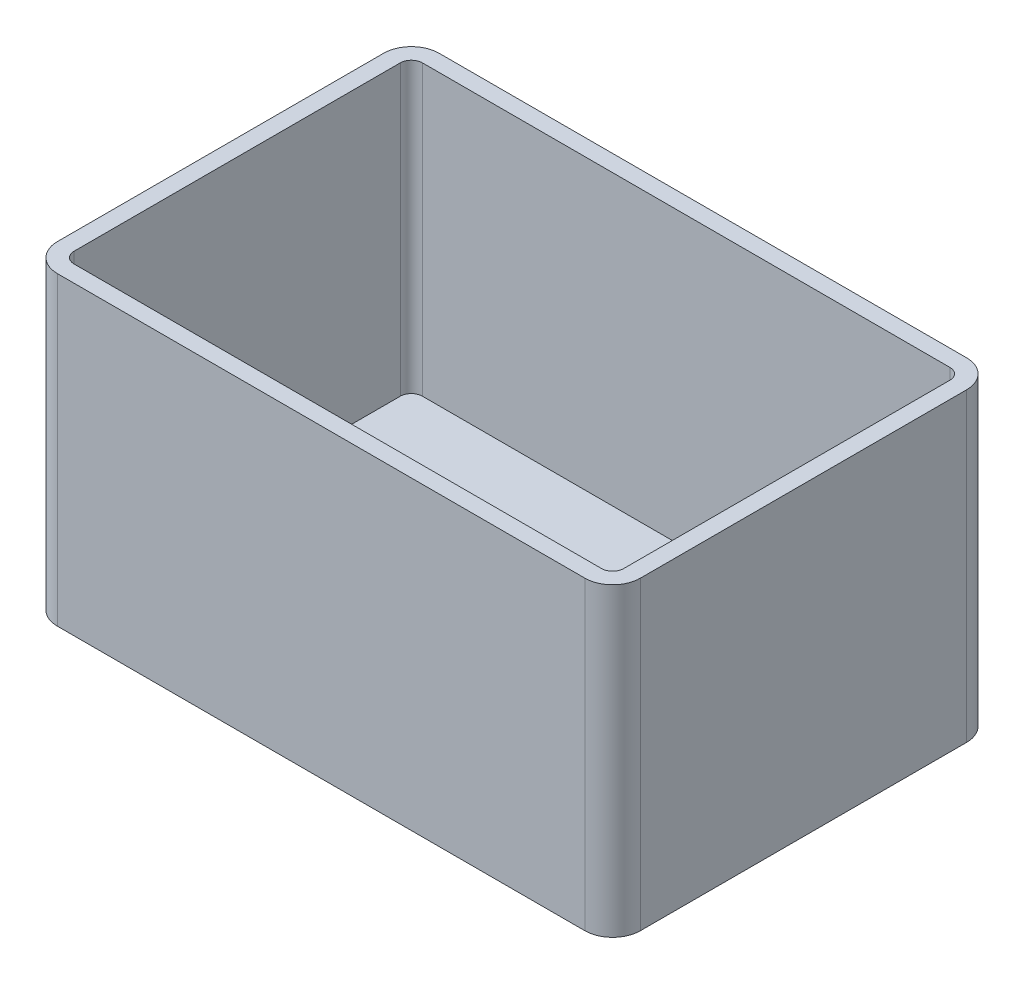
from build123d import *

# Parameters (mm, degrees)
BOSS_EXTRUDE1_DEPTH          = 55
SHELL1_T                     = -3
CUT_EXTRUDE1_DEPTH           = 2
BATTERY_CONNECTOR_SKETCH_3_R = 2.15
CUT_EXTRUDE2_DEPTH           = 3
BATTERY_CONNECTOR_SKETCH_4_R = 2.15
CUT_EXTRUDE3_DEPTH           = 3


with BuildPart() as part:
    # Sketch2 → Boss-Extrude1 (new body)
    with BuildSketch(Plane(origin=(0, 0, 0), x_dir=(1, 0, 0), z_dir=(0, 1, 0))):
        with BuildLine():
            Line((47.5, -34.375), (-47.5, -34.375))
            ThreePointArc((-47.5, -34.375), (-51.035533906, -32.910533906), (-52.5, -29.375))
            Line((-52.5, -29.375), (-52.5, 29.375))
            ThreePointArc((-52.5, 29.375), (-51.035533906, 32.910533906), (-47.5, 34.375))
            Line((-47.5, 34.375), (47.5, 34.375))
            ThreePointArc((47.5, 34.375), (51.035533906, 32.910533906), (52.5, 29.375))
            Line((52.5, 29.375), (52.5, -29.375))
            ThreePointArc((52.5, -29.375), (51.035533906, -32.910533906), (47.5, -34.375))
        make_face()
    extrude(amount=BOSS_EXTRUDE1_DEPTH)

    # Shell1
    shell1_openings = [part.faces().sort_by_distance(p)[0] for p in [
        (0, 55, 0),
    ]]
    offset(amount=SHELL1_T, openings=shell1_openings, kind=Kind.INTERSECTION)

    # battery_connector_sketch → Cut-Extrude1 (cut)
    with BuildSketch(Plane(origin=(0, 3, 0), x_dir=(1, 0, 0), z_dir=(0, 1, 0))):
        with BuildLine():
            Line((-48.255414742, -4.831437415), (-48.255414742, -29.131437415))
            ThreePointArc((-48.255414742, -29.131437415), (-47.669628305, -30.545650977), (-46.255414742, -31.131437415))
            Line((-46.255414742, -31.131437415), (-40.255414742, -31.131437415))
            ThreePointArc((-40.255414742, -31.131437415), (-38.84120118, -30.545650977), (-38.255414742, -29.131437415))
            Line((-38.255414742, -29.131437415), (-38.255414742, -21.901437415))
            Line((-38.255414742, -21.901437415), (-39.505414742, -20.561437415))
            Line((-39.505414742, -20.561437415), (-39.505414742, -13.401437415))
            Line((-39.505414742, -13.401437415), (-38.255414742, -12.061437415))
            Line((-38.255414742, -12.061437415), (-38.255414742, -4.831437415))
            ThreePointArc((-38.255414742, -4.831437415), (-38.84120118, -3.417223852), (-40.255414742, -2.831437415))
            Line((-40.255414742, -2.831437415), (-46.255414742, -2.831437415))
            ThreePointArc((-46.255414742, -2.831437415), (-47.669628305, -3.417223852), (-48.255414742, -4.831437415))
        make_face()
    extrude(amount=-CUT_EXTRUDE1_DEPTH, mode=Mode.SUBTRACT)

    # battery_connector_sketch<3> → Cut-Extrude2 (cut)
    with BuildSketch(Plane(origin=(0, 3, 0), x_dir=(1, 0, 0), z_dir=(0, 1, 0))):
        with Locations((-43.255414742, -6.881437415)):
            Circle(BATTERY_CONNECTOR_SKETCH_3_R)
    extrude(amount=-CUT_EXTRUDE2_DEPTH, mode=Mode.SUBTRACT)

    # battery_connector_sketch<4> → Cut-Extrude3 (cut)
    with BuildSketch(Plane(origin=(0, 3, 0), x_dir=(1, 0, 0), z_dir=(0, 1, 0))):
        with Locations((-43.255414742, -24.831437415)):
            Circle(BATTERY_CONNECTOR_SKETCH_4_R)
    extrude(amount=-CUT_EXTRUDE3_DEPTH, mode=Mode.SUBTRACT)


solid = part.part
